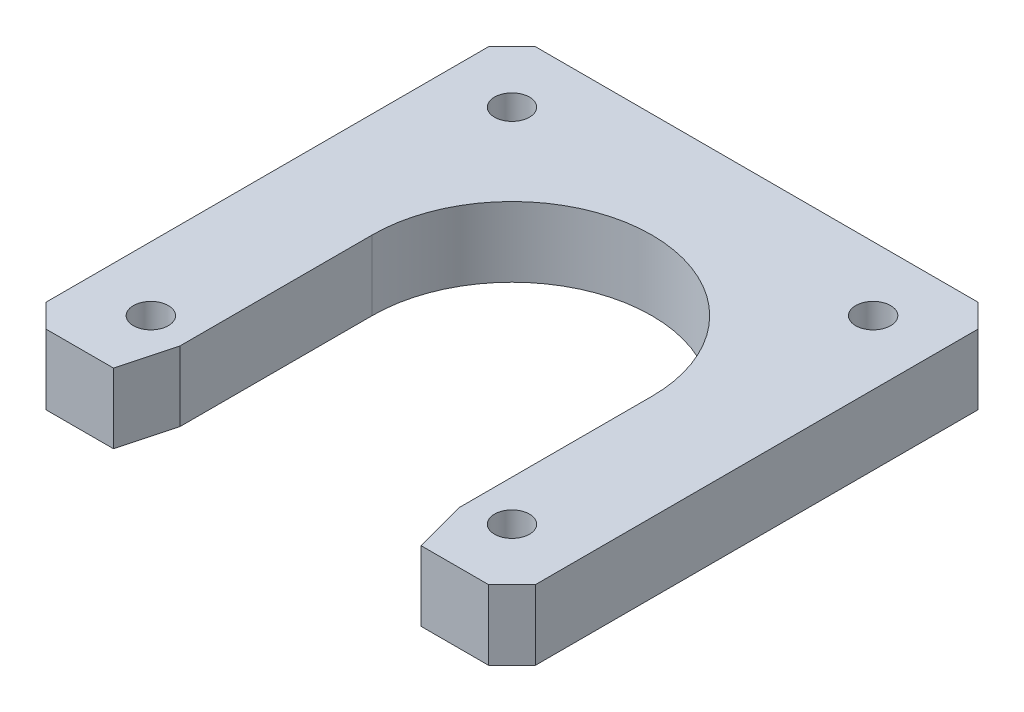
from build123d import *
from OCP.BRepFilletAPI import BRepFilletAPI_MakeChamfer

# Parameters (mm, degrees)
SKETCH1_W           = 42
SKETCH1_H           = 42
SKETCH1_R           = 12
SKETCH1_R_2         = 1.5
BOSS_EXTRUDE1_DEPTH = 6
CHAMFER1_SIZE       = 2
SKETCH2_W           = 24
SKETCH2_H           = 21
CUT_EXTRUDE1_DEPTH  = 31.298514815
CHAMFER2_SIZE       = 4.5
CHAMFER2_SIZE2      = 1.205771366


with BuildPart() as part:
    # Sketch1 → Boss-Extrude1 (new body)
    with BuildSketch(Plane(origin=(0, 0, 0), x_dir=(1, 0, 0), z_dir=(0, 1, 0))):
        Rectangle(SKETCH1_W, SKETCH1_H)
        Circle(SKETCH1_R, mode=Mode.SUBTRACT)
        with Locations((-15.5, 15.5)):
            Circle(SKETCH1_R_2, mode=Mode.SUBTRACT)
        with Locations((15.5, 15.5)):
            Circle(SKETCH1_R_2, mode=Mode.SUBTRACT)
        with Locations((15.5, -15.5)):
            Circle(SKETCH1_R_2, mode=Mode.SUBTRACT)
        with Locations((-15.5, -15.5)):
            Circle(SKETCH1_R_2, mode=Mode.SUBTRACT)
    extrude(amount=BOSS_EXTRUDE1_DEPTH)

    # Chamfer1
    chamfer1_edges = [part.edges().sort_by_distance(p)[0] for p in [
        (-21, 3, -21),
        (21, 3, -21),
        (21, 3, 21),
        (-21, 3, 21),
    ]]
    chamfer(chamfer1_edges, length=CHAMFER1_SIZE)

    # Sketch2 → Cut-Extrude1 (cut, through all)
    with BuildSketch(Plane(origin=(0, 6, 0), x_dir=(1, 0, 0), z_dir=(0, 1, 0))):
        with Locations((0, -10.5)):
            Rectangle(SKETCH2_W, SKETCH2_H)
    extrude(amount=-CUT_EXTRUDE1_DEPTH, mode=Mode.SUBTRACT)

    # Chamfer2: one chamfer whose edges measure the first distance from different faces: ONE call of the kernel's chamfer builder (chamfer() names one face for all edges)
    chamfer2_edges_1 = [part.edges().sort_by_distance(p)[0] for p in [
        (12, 3, 21),
    ]]
    chamfer2_side_1 = [part.faces().sort_by_distance(p)[0] for p in [
        (12, 3, 10.5),
    ]]
    chamfer2_edges_2 = [part.edges().sort_by_distance(p)[0] for p in [
        (-12, 3, 21),
    ]]
    chamfer2_side_2 = [part.faces().sort_by_distance(p)[0] for p in [
        (-12, 3, 10.5),
    ]]
    chamfer2 = BRepFilletAPI_MakeChamfer(part.part.solid().wrapped)
    for e in chamfer2_edges_1:
        chamfer2.Add(CHAMFER2_SIZE, CHAMFER2_SIZE2, e.wrapped, chamfer2_side_1[0].wrapped)  # the first distance lies on this face
    for e in chamfer2_edges_2:
        chamfer2.Add(CHAMFER2_SIZE, CHAMFER2_SIZE2, e.wrapped, chamfer2_side_2[0].wrapped)  # the first distance lies on this face
    add(Compound.cast(chamfer2.Shape()), mode=Mode.REPLACE)


solid = part.part
